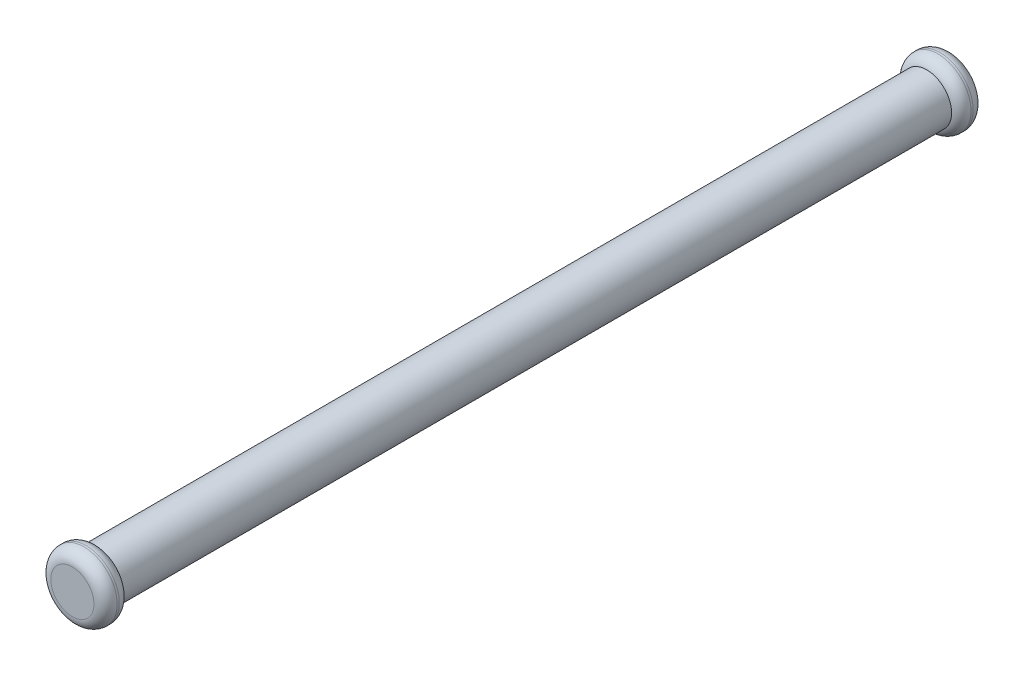
from build123d import *

# Parameters (mm, degrees)
ESBO_O1_R                = 1.5
RESSALTO_EXTRUS_O1_DEPTH = 50
ESBO_O2_R                = 2
RESSALTO_EXTRUS_O2_DEPTH = 1.5
RESSALTO_EXTRUS_O3_START = -51.5
ESBO_O2_2_R              = 2
RESSALTO_EXTRUS_O3_DEPTH = 1.5
FILETE1_R                = 0.7


with BuildPart() as part:
    # Esboço1 → Ressalto-extrusão1 (new body)
    with BuildSketch(Plane.XY):
        with Locations((-20, 2.5)):
            Circle(ESBO_O1_R)
    extrude(amount=-RESSALTO_EXTRUS_O1_DEPTH)

    # Esboço2 → Ressalto-extrusão2 (add)
    with BuildSketch(Plane.XY):
        with Locations((-20, 2.5)):
            Circle(ESBO_O2_R)
    extrude(amount=RESSALTO_EXTRUS_O2_DEPTH)

    # Esboço2<2> → Ressalto-extrusão3 (add)
    with BuildSketch(Plane.XY.offset(RESSALTO_EXTRUS_O3_START)):
        with Locations((-20, 2.5)):
            Circle(ESBO_O2_2_R)
    extrude(amount=RESSALTO_EXTRUS_O3_DEPTH)

    # Filete1
    # the kernel refuses this fillet: 0.7 mm, written as the material it takes off along each edge
    with BuildSketch(Plane(origin=(-20, 2.5, 0), x_dir=(1, 0, 0), z_dir=(0, -1, 0))) as filete1_piece_1:
        with BuildLine():
            CenterArc((1.3, 0.670820393), FILETE1_R, 286.601549599, 73.398450401)
            Line((2, 0.670820393), (2.014, 0.670820393))
            Line((2.014, 0.670820393), (2.014, 0))
            Line((2.014, 0), (2, -0.014))
            ThreePointArc((2, -0.014), (1.75, -0.014), (1.504, -0.013416408))
            Line((1.504, -0.013416408), (1.5, 0))
        make_face()
    revolve(axis=Axis((-20, 2.5, 0), (0, 0, 1)), mode=Mode.SUBTRACT)
    with BuildSketch(Plane(origin=(-20, 2.5, 1.5), x_dir=(1, 0, 0), z_dir=(0, -1, 0))) as filete1_piece_2:
        with BuildLine():
            CenterArc((2 - FILETE1_R, -FILETE1_R), FILETE1_R, 0, 90)
            Line((2 - FILETE1_R, 0), (2 - FILETE1_R, FILETE1_R * 0.02))
            Line((2 - FILETE1_R, FILETE1_R * 0.02), (2 + FILETE1_R * 0.02, FILETE1_R * 0.02))
            Line((2 + FILETE1_R * 0.02, FILETE1_R * 0.02), (2 + FILETE1_R * 0.02, -FILETE1_R))
            Line((2 + FILETE1_R * 0.02, -FILETE1_R), (2, -FILETE1_R))
        make_face()
    revolve(axis=Axis((-20, 2.5, 1.5), (0, 0, 1)), mode=Mode.SUBTRACT)
    with BuildSketch(Plane(origin=(-20, 2.5, -50), x_dir=(1, 0, 0), z_dir=(0, -1, 0))) as filete1_piece_3:
        with BuildLine():
            CenterArc((1.3, -0.670820393), FILETE1_R, 0, 73.398450401)
            Line((1.5, 0), (1.504, 0.013416408))
            ThreePointArc((1.504, 0.013416408), (1.75, 0.014), (2, 0.014))
            Line((2, 0.014), (2.014, 0))
            Line((2.014, 0), (2.014, -0.670820393))
            Line((2.014, -0.670820393), (2, -0.670820393))
        make_face()
    revolve(axis=Axis((-20, 2.5, -50), (0, 0, 1)), mode=Mode.SUBTRACT)
    with BuildSketch(Plane(origin=(-20, 2.5, -51.5), x_dir=(1, 0, 0), z_dir=(0, -1, 0))) as filete1_piece_4:
        with BuildLine():
            CenterArc((2 - FILETE1_R, FILETE1_R), FILETE1_R, 270, 90)
            Line((2 - FILETE1_R, 0), (2 - FILETE1_R, -FILETE1_R * 0.02))
            Line((2 - FILETE1_R, -FILETE1_R * 0.02), (2 + FILETE1_R * 0.02, -FILETE1_R * 0.02))
            Line((2 + FILETE1_R * 0.02, -FILETE1_R * 0.02), (2 + FILETE1_R * 0.02, FILETE1_R))
            Line((2 + FILETE1_R * 0.02, FILETE1_R), (2, FILETE1_R))
        make_face()
    revolve(axis=Axis((-20, 2.5, -51.5), (0, 0, 1)), mode=Mode.SUBTRACT)


solid = part.part
